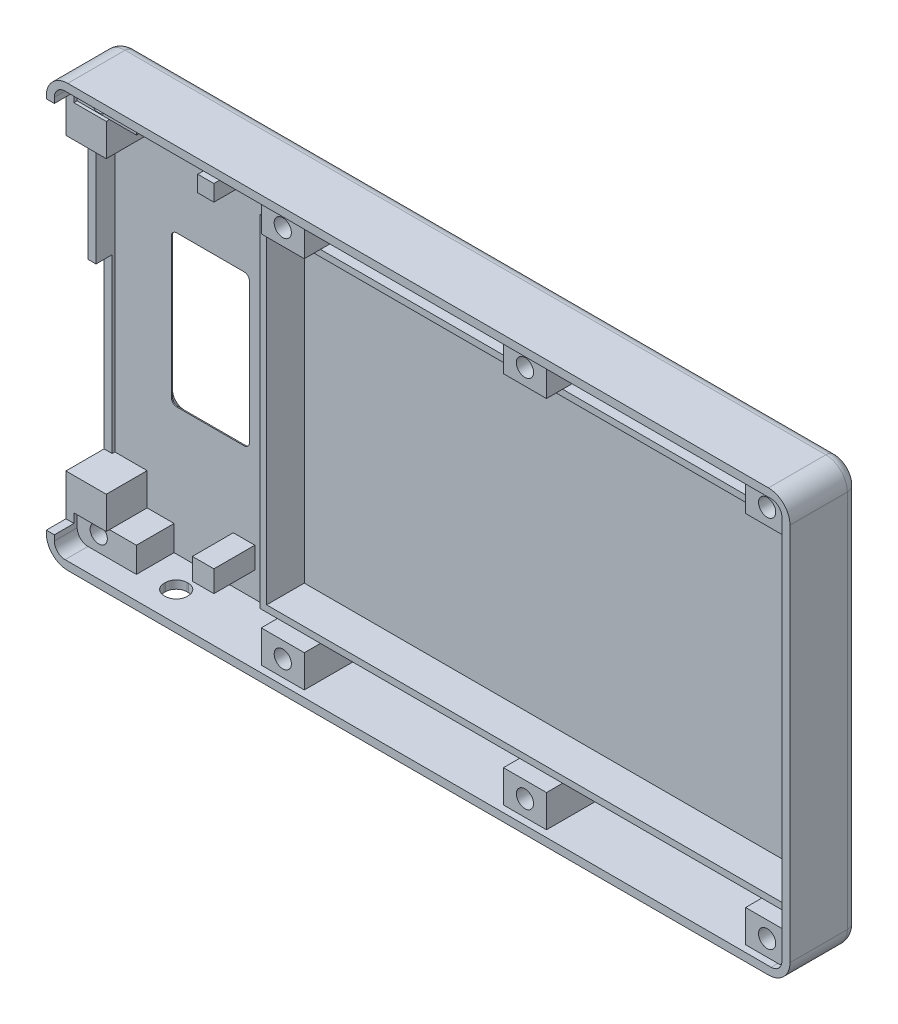
from build123d import *

# Parameters (mm, degrees)
BOSS_EXTRU_1_DEPTH           = 12.65
ESQUISSE1_4_W                = 135.2
ESQUISSE1_4_H                = 75.4
BOSS_EXTRU_2_DEPTH           = 1.4
BOSS_EXTRU_5_START           = 1.4
ESQUISSE1_5_W                = 8
ESQUISSE1_5_H                = 6
ESQUISSE1_5_R                = 1.25
BOSS_EXTRU_5_DEPTH           = 10
BOSS_EXTRU_5_2_DEPTH         = 10
BOSS_EXTRU_5_3_DEPTH         = 10
BOSS_EXTRU_5_4_DEPTH         = 10
BOSS_EXTRU_5_5_DEPTH         = 10
BOSS_EXTRU_5_6_DEPTH         = 10
BOSS_EXTRU_7_START           = 1.4
BOSS_EXTRU_7_DEPTH           = 7
CONG_1_R                     = 4
CONG_2_R                     = 2
ENL_V_MAT_EXTRU_2_DEPTH      = 4.3
ENL_V_MAT_EXTRU_2_DEPTH_BACK = 60.5
ESQUISSE4_R                  = 1.6
BOSS_EXTRU_9_START           = 1.4
ESQUISSE1_9_W                = 6
ESQUISSE1_9_H                = 6
ESQUISSE1_9_W_2              = 4
ESQUISSE1_9_H_2              = 4
ESQUISSE1_9_W_3              = 3
ESQUISSE1_9_H_3              = 3
BOSS_EXTRU_9_DEPTH           = 7.6
ESQUISSE5_W                  = 11
ESQUISSE5_H                  = 4.7
BOSS_EXTRU_10_DEPTH          = 7
ESQUISSE6_R                  = 1.6
ENL_V_MAT_EXTRU_3_DEPTH      = 40
CHANFREIN3_SIZE              = 1.48
ENL_V_MAT_EXTRU_6_DEPTH      = 1.4
ENL_V_MAT_EXTRU_7_DEPTH      = 3
CHANFREIN4_SIZE              = 1.2
CONG_3_R                     = 2
ESQUISSE12_W                 = 1.5
ESQUISSE12_H                 = 32
ENL_V_MAT_EXTRU_8_DEPTH      = 10.75
ESQUISSE13_W                 = 1.5
ESQUISSE13_H                 = 22
ENL_V_MAT_EXTRU_9_DEPTH      = 7.75
ESQUISSE11_W                 = 1.5
ESQUISSE11_H                 = 7.7
ENL_V_MAT_EXTRU_10_DEPTH     = 3.65


with BuildPart() as part:
    # Esquisse1 → Boss.-Extru.1 (new body)
    with BuildSketch(Plane.XY):
        Polygon((135.2, 75.4), (135.2, 69.4), (135.2, 68.2), (135.2, 37.7), (136.7, 37.7), (136.7, 76.9), (-1.5, 76.9), (-1.5, 37.7), (0, 37.7), (0, 64.7), (0, 70.7), (0, 72.1), (0, 75.4), (37.2, 75.4), (45.2, 75.4), (82.2, 75.4), (90.2, 75.4), (127.2, 75.4), align=None)
        Polygon((136.7, 37.7), (135.2, 37.7), (135.2, 7.2), (135.2, 6), (135.2, 0), (127.2, 0), (90.2, 0), (82.2, 0), (45.2, 0), (37.2, 0), (0, 0), (0, 3.3), (0, 4.7), (0, 10.7), (0, 37.7), (-1.5, 37.7), (-1.5, -1.5), (136.7, -1.5), align=None)
    extrude(amount=BOSS_EXTRU_1_DEPTH)

    # Esquisse1<4> → Boss.-Extru.2 (add)
    with BuildSketch(Plane.XY):
        with Locations((67.6, 37.7)):
            Rectangle(ESQUISSE1_4_W, ESQUISSE1_4_H)
    extrude(amount=BOSS_EXTRU_2_DEPTH)

    # Esquisse1<6> → Boss.-Extru.7 (add)
    with BuildSketch(Plane.XY.offset(BOSS_EXTRU_7_START)):
        Polygon((135.2, 68.2), (135.2, 69.4), (127.2, 69.4), (90.2, 69.4), (82.2, 69.4), (45.2, 69.4), (37.2, 69.4), (34, 69.4), (34, 37.7), (35.2, 37.7), (35.2, 68.2), align=None)
        Polygon((135.2, 6), (135.2, 7.2), (35.2, 7.2), (35.2, 37.7), (34, 37.7), (34, 6), (37.2, 6), (45.2, 6), (82.2, 6), (90.2, 6), (127.2, 6), align=None)
    extrude(amount=BOSS_EXTRU_7_DEPTH)

    # Congé1
    cong_1_edges = [part.edges().sort_by_distance(p)[0] for p in [
        (-1.5, 76.9, 6.325),
        (136.7, 76.9, 6.325),
        (136.7, -1.5, 6.325),
        (-1.5, -1.5, 6.325),
    ]]
    fillet(cong_1_edges, radius=CONG_1_R)

    # Congé2
    cong_2_edges = [part.edges().sort_by_distance(p)[0] for p in [
        (135.2, 0, 7.025),
        (135.2, 75.4, 7.025),
        (0, 75.4, 7.025),
        (0, 0, 7.025),
    ]]
    fillet(cong_2_edges, radius=CONG_2_R)


with BuildPart() as body_2:
    # Esquisse1<5> → Boss.-Extru.5 (new body)
    with BuildSketch(Plane.XY.offset(BOSS_EXTRU_5_START)):
        with Locations((131.2, 72.4)):
            Rectangle(ESQUISSE1_5_W, ESQUISSE1_5_H)
        with Locations(Location((131.2, 72.4, 0), (0, 0, 180))):
            Circle(ESQUISSE1_5_R, mode=Mode.SUBTRACT)
    extrude(amount=BOSS_EXTRU_5_DEPTH)


with BuildPart() as body_3:
    # Esquisse1<5> → Boss.-Extru.5 2 (new body)
    with BuildSketch(Plane.XY.offset(BOSS_EXTRU_5_START)):
        with Locations((86.2, 72.4)):
            Rectangle(ESQUISSE1_5_W, ESQUISSE1_5_H)
        with Locations(Location((86.2, 72.4, 0), (0, 0, 180))):
            Circle(ESQUISSE1_5_R, mode=Mode.SUBTRACT)
    extrude(amount=BOSS_EXTRU_5_2_DEPTH)


with BuildPart() as body_4:
    # Esquisse1<5> → Boss.-Extru.5 3 (new body)
    with BuildSketch(Plane.XY.offset(BOSS_EXTRU_5_START)):
        with Locations((131.2, 3)):
            Rectangle(ESQUISSE1_5_W, ESQUISSE1_5_H)
        with Locations(Location((131.2, 3, 0), (0, 0, 180))):
            Circle(ESQUISSE1_5_R, mode=Mode.SUBTRACT)
    extrude(amount=BOSS_EXTRU_5_3_DEPTH)


with BuildPart() as body_5:
    # Esquisse1<5> → Boss.-Extru.5 4 (new body)
    with BuildSketch(Plane.XY.offset(BOSS_EXTRU_5_START)):
        with Locations((41.2, 72.4)):
            Rectangle(ESQUISSE1_5_W, ESQUISSE1_5_H)
        with Locations(Location((41.2, 72.4, 0), (0, 0, 180))):
            Circle(ESQUISSE1_5_R, mode=Mode.SUBTRACT)
    extrude(amount=BOSS_EXTRU_5_4_DEPTH)


with BuildPart() as body_6:
    # Esquisse1<5> → Boss.-Extru.5 5 (new body)
    with BuildSketch(Plane.XY.offset(BOSS_EXTRU_5_START)):
        with Locations((86.2, 3)):
            Rectangle(ESQUISSE1_5_W, ESQUISSE1_5_H)
        with Locations(Location((86.2, 3, 0), (0, 0, 180))):
            Circle(ESQUISSE1_5_R, mode=Mode.SUBTRACT)
    extrude(amount=BOSS_EXTRU_5_5_DEPTH)


with BuildPart() as body_7:
    # Esquisse1<5> → Boss.-Extru.5 6 (new body)
    with BuildSketch(Plane.XY.offset(BOSS_EXTRU_5_START)):
        with Locations((41.2, 3)):
            Rectangle(ESQUISSE1_5_W, ESQUISSE1_5_H)
        with Locations(Location((41.2, 3, 0), (0, 0, 180))):
            Circle(ESQUISSE1_5_R, mode=Mode.SUBTRACT)
    extrude(amount=BOSS_EXTRU_5_6_DEPTH)


with BuildPart() as enl_v_mat_extru_2_tool:
    # Esquisse4 → Enlèv. mat.-Extru.2 (new, two sides: drawn at the far end of the back side and taken through both)
    with BuildSketch(Plane(origin=(0, 0, 0), x_dir=(-1, 0, 0), z_dir=(0, 0, -1)).offset(-ENL_V_MAT_EXTRU_2_DEPTH_BACK)):
        with Locations(Location((-41.2, 3, 0), (0, 0, 180))):
            Circle(ESQUISSE4_R)
        with Locations(Location((-86.2, 3, 0), (0, 0, 180))):
            Circle(ESQUISSE4_R)
        with Locations(Location((-131.2, 3, 0), (0, 0, 180))):
            Circle(ESQUISSE4_R)
        with Locations(Location((-131.2, 72.4, 0), (0, 0, 180))):
            Circle(ESQUISSE4_R)
        with Locations(Location((-86.2, 72.4, 0), (0, 0, 180))):
            Circle(ESQUISSE4_R)
        with Locations(Location((-41.2, 72.4, 0), (0, 0, 180))):
            Circle(ESQUISSE4_R)
    extrude(amount=ENL_V_MAT_EXTRU_2_DEPTH + ENL_V_MAT_EXTRU_2_DEPTH_BACK)


with BuildPart() as part_1:
    add(part.part)

    # Enlèv. mat.-Extru.2: cut by enl_v_mat_extru_2_tool
    add(enl_v_mat_extru_2_tool.part, mode=Mode.SUBTRACT)

    # Esquisse1<9> → Boss.-Extru.9 (add)
    with BuildSketch(Plane.XY.offset(BOSS_EXTRU_9_START)):
        with Locations((3, 7.7)):
            Rectangle(ESQUISSE1_9_W, ESQUISSE1_9_H)
        with Locations((24, 6.7)):
            Rectangle(ESQUISSE1_9_W_2, ESQUISSE1_9_H_2)
        with Locations((3, 67.7)):
            Rectangle(ESQUISSE1_9_W, ESQUISSE1_9_H)
        with Locations((24.5, 69.2)):
            Rectangle(ESQUISSE1_9_W_3, ESQUISSE1_9_H_3)
    extrude(amount=BOSS_EXTRU_9_DEPTH)

    # Esquisse5 → Boss.-Extru.10 (add)
    with BuildSketch(Plane.XY.offset(1.4)):
        with Locations((5.5, 73.05)):
            Rectangle(ESQUISSE5_W, ESQUISSE5_H)
        with Locations((5.5, 2.35)):
            Rectangle(ESQUISSE5_W, ESQUISSE5_H)
    extrude(amount=BOSS_EXTRU_10_DEPTH)

    # Esquisse6 → Enlèv. mat.-Extru.3 (cut)
    with BuildSketch(Plane(origin=(0, 0, 0), x_dir=(-1, 0, 0), z_dir=(0, 0, -1))):
        with Locations((-4, 3)):
            Circle(ESQUISSE6_R)
        with Locations((-4, 72.4)):
            Circle(ESQUISSE6_R)
    extrude(amount=-ENL_V_MAT_EXTRU_3_DEPTH, mode=Mode.SUBTRACT)

    # Chanfrein3
    # the kernel refuses this chamfer: 1.48 mm, written as the material it takes off along each edge
    with BuildSketch(Plane(origin=(41.2, 3, 0), x_dir=(1, 0, 0), z_dir=(0, 1, 0))) as chanfrein3_piece_1:
        Polygon((1.6 + CHANFREIN3_SIZE, 0), (1.6, -CHANFREIN3_SIZE), (1.6, 0), align=None)
    revolve(axis=Axis((41.2, 3, 0), (0, 0, -1)), mode=Mode.SUBTRACT)
    with BuildSketch(Plane(origin=(86.2, 3, 0), x_dir=(1, 0, 0), z_dir=(0, 1, 0))) as chanfrein3_piece_2:
        Polygon((1.6 + CHANFREIN3_SIZE, 0), (1.6, -CHANFREIN3_SIZE), (1.6, 0), align=None)
    revolve(axis=Axis((86.2, 3, 0), (0, 0, -1)), mode=Mode.SUBTRACT)
    with BuildSketch(Plane(origin=(131.2, 3, 0), x_dir=(1, 0, 0), z_dir=(0, 1, 0))) as chanfrein3_piece_3:
        Polygon((1.6 + CHANFREIN3_SIZE, 0), (1.6, -CHANFREIN3_SIZE), (1.6, 0), align=None)
    revolve(axis=Axis((131.2, 3, 0), (0, 0, -1)), mode=Mode.SUBTRACT)
    with BuildSketch(Plane(origin=(131.2, 72.4, 0), x_dir=(1, 0, 0), z_dir=(0, 1, 0))) as chanfrein3_piece_4:
        Polygon((1.6 + CHANFREIN3_SIZE, 0), (1.6, -CHANFREIN3_SIZE), (1.6, 0), align=None)
    revolve(axis=Axis((131.2, 72.4, 0), (0, 0, -1)), mode=Mode.SUBTRACT)
    with BuildSketch(Plane(origin=(86.2, 72.4, 0), x_dir=(1, 0, 0), z_dir=(0, 1, 0))) as chanfrein3_piece_5:
        Polygon((1.6 + CHANFREIN3_SIZE, 0), (1.6, -CHANFREIN3_SIZE), (1.6, 0), align=None)
    revolve(axis=Axis((86.2, 72.4, 0), (0, 0, -1)), mode=Mode.SUBTRACT)
    with BuildSketch(Plane(origin=(41.2, 72.4, 0), x_dir=(1, 0, 0), z_dir=(0, 1, 0))) as chanfrein3_piece_6:
        Polygon((1.6 + CHANFREIN3_SIZE, 0), (1.6, -CHANFREIN3_SIZE), (1.6, 0), align=None)
    revolve(axis=Axis((41.2, 72.4, 0), (0, 0, -1)), mode=Mode.SUBTRACT)
    with BuildSketch(Plane(origin=(4, 3, 0), x_dir=(-1, 0, 0), z_dir=(0, -1, 0))) as chanfrein3_piece_7:
        Polygon((1.6 + CHANFREIN3_SIZE, 0), (1.6, -CHANFREIN3_SIZE), (1.6, 0), align=None)
    revolve(axis=Axis((4, 3, 0), (0, 0, -1)), mode=Mode.SUBTRACT)
    with BuildSketch(Plane(origin=(4, 72.4, 0), x_dir=(-1, 0, 0), z_dir=(0, -1, 0))) as chanfrein3_piece_8:
        Polygon((1.6 + CHANFREIN3_SIZE, 0), (1.6, -CHANFREIN3_SIZE), (1.6, 0), align=None)
    revolve(axis=Axis((4, 72.4, 0), (0, 0, -1)), mode=Mode.SUBTRACT)

    # Esquisse9 → Enlèv. mat.-Extru.6 (cut)
    with BuildSketch(Plane(origin=(0, 0, 0), x_dir=(-1, 0, 0), z_dir=(0, 0, -1))):
        with BuildLine():
            Line((-11.5, 23.7), (-24, 23.7))
            ThreePointArc((-24, 23.7), (-24.707106781, 23.992893219), (-25, 24.7))
            Line((-25, 24.7), (-25, 50.7))
            ThreePointArc((-25, 50.7), (-24.707106781, 51.407106781), (-24, 51.7))
            Line((-24, 51.7), (-11.5, 51.7))
            ThreePointArc((-11.5, 51.7), (-10.792893219, 51.407106781), (-10.5, 50.7))
            Line((-10.5, 50.7), (-10.5, 24.7))
            ThreePointArc((-10.5, 24.7), (-10.792893219, 23.992893219), (-11.5, 23.7))
        make_face()
    extrude(amount=-ENL_V_MAT_EXTRU_6_DEPTH, mode=Mode.SUBTRACT)

    # Esquisse10 → Enlèv. mat.-Extru.7 (cut)
    with BuildSketch(Plane.XZ.offset(1.5)):
        with BuildLine():
            Line((17.25, 9.25), (17, 9.25))
            ThreePointArc((17, 9.25), (15.585786438, 8.664213562), (15, 7.25))
            Line((15, 7.25), (15, 7))
            ThreePointArc((15, 7), (15.585786438, 5.585786438), (17, 5))
            Line((17, 5), (17.25, 5))
            ThreePointArc((17.25, 5), (18.664213562, 5.585786438), (19.25, 7))
            Line((19.25, 7), (19.25, 7.25))
            ThreePointArc((19.25, 7.25), (18.664213562, 8.664213562), (17.25, 9.25))
        make_face()
    extrude(amount=-ENL_V_MAT_EXTRU_7_DEPTH, mode=Mode.SUBTRACT)

    # Chanfrein4
    chanfrein4_edges = [part_1.edges().sort_by_distance(p)[0] for p in [
        (10.792893219, 51.407106781, 0),
        (17.75, 51.7, 0),
        (24.707106781, 51.407106781, 0),
        (25, 37.7, 0),
        (24.707106781, 23.992893219, 0),
        (17.75, 23.7, 0),
        (10.792893219, 23.992893219, 0),
        (10.5, 37.7, 0),
    ]]
    chamfer(chanfrein4_edges, length=CHANFREIN4_SIZE)

    # Congé3
    # the kernel refuses this fillet: 2 mm, written as the material it takes off along each edge
    with BuildSketch(Plane(origin=(-1.5, 2.5, 0), x_dir=(1, 0, 0), z_dir=(0, 1, 0)), Plane(origin=(136.7, 72.9, 0), x_dir=(-1, 0, 0), z_dir=(0, -1, 0))) as cong_3_piece_1:
        with BuildLine():
            CenterArc((CONG_3_R, -CONG_3_R), CONG_3_R, 90, 90)
            Line((0, -CONG_3_R), (0, 0))
            Line((0, 0), (CONG_3_R, 0))
        make_face()
    extrude(amount=70.4, mode=Mode.SUBTRACT)
    with BuildSketch(Plane(origin=(132.7, 76.9, 0), x_dir=(0, -1, 0), z_dir=(-1, 0, 0)), Plane(origin=(2.5, -1.5, 0), x_dir=(0, 1, 0), z_dir=(1, 0, 0))) as cong_3_piece_2:
        with BuildLine():
            CenterArc((CONG_3_R, CONG_3_R), CONG_3_R, 180, 90)
            Line((0, CONG_3_R), (0, 0))
            Line((0, 0), (CONG_3_R, 0))
        make_face()
    extrude(amount=130.2, mode=Mode.SUBTRACT)
    with BuildSketch(Plane(origin=(132.7, 72.9, 0), x_dir=(0, 1, 0), z_dir=(-1, 0, 0))) as cong_3_piece_3:
        with BuildLine():
            CenterArc((4 - CONG_3_R, -CONG_3_R), CONG_3_R, 0, 90)
            Line((4, -CONG_3_R), (4, 0))
            Line((4, 0), (4 - CONG_3_R, 0))
        make_face()
    revolve(axis=Axis((132.7, 72.9, 0), (0, 0, -1)), revolution_arc=90, mode=Mode.SUBTRACT)
    with BuildSketch(Plane(origin=(132.7, 2.5, 0), x_dir=(0, -1, 0), z_dir=(-1, 0, 0))) as cong_3_piece_4:
        with BuildLine():
            CenterArc((4 - CONG_3_R, CONG_3_R), CONG_3_R, 270, 90)
            Line((4, CONG_3_R), (4, 0))
            Line((4, 0), (4 - CONG_3_R, 0))
        make_face()
    revolve(axis=Axis((132.7, 2.5, 0), (0, 0, 1)), revolution_arc=90, mode=Mode.SUBTRACT)
    with BuildSketch(Plane(origin=(2.5, 2.5, 0), x_dir=(-1, 0, 0), z_dir=(0, 1, 0))) as cong_3_piece_5:
        with BuildLine():
            CenterArc((4 - CONG_3_R, CONG_3_R), CONG_3_R, 270, 90)
            Line((4, CONG_3_R), (4, 0))
            Line((4, 0), (4 - CONG_3_R, 0))
        make_face()
    revolve(axis=Axis((2.5, 2.5, 0), (0, 0, 1)), revolution_arc=90, mode=Mode.SUBTRACT)
    with BuildSketch(Plane(origin=(2.5, 72.9, 0), x_dir=(0, 1, 0), z_dir=(1, 0, 0))) as cong_3_piece_6:
        with BuildLine():
            CenterArc((4 - CONG_3_R, CONG_3_R), CONG_3_R, 270, 90)
            Line((4, CONG_3_R), (4, 0))
            Line((4, 0), (4 - CONG_3_R, 0))
        make_face()
    revolve(axis=Axis((2.5, 72.9, 0), (0, 0, 1)), revolution_arc=90, mode=Mode.SUBTRACT)

    # Esquisse12 → Enlèv. mat.-Extru.8 (cut)
    with BuildSketch(Plane.XY.offset(12.65)):
        with Locations((-0.75, 26.7)):
            Rectangle(ESQUISSE12_W, ESQUISSE12_H)
    extrude(amount=-ENL_V_MAT_EXTRU_8_DEPTH, mode=Mode.SUBTRACT)

    # Esquisse13 → Enlèv. mat.-Extru.9 (cut)
    with BuildSketch(Plane.XY.offset(12.65)):
        with Locations((-0.75, 53.7)):
            Rectangle(ESQUISSE13_W, ESQUISSE13_H)
    extrude(amount=-ENL_V_MAT_EXTRU_9_DEPTH, mode=Mode.SUBTRACT)

    # Esquisse11 → Enlèv. mat.-Extru.10 (cut)
    with BuildSketch(Plane.XY.offset(12.65)):
        with Locations((-0.75, 68.55)):
            Rectangle(ESQUISSE11_W, ESQUISSE11_H)
        with Locations((-0.75, 6.85)):
            Rectangle(ESQUISSE11_W, ESQUISSE11_H)
    extrude(amount=-ENL_V_MAT_EXTRU_10_DEPTH, mode=Mode.SUBTRACT)


with BuildPart() as body_2_1:
    add(body_2.part)

    # Enlèv. mat.-Extru.2: cut by enl_v_mat_extru_2_tool
    add(enl_v_mat_extru_2_tool.part, mode=Mode.SUBTRACT)


with BuildPart() as body_3_1:
    add(body_3.part)

    # Enlèv. mat.-Extru.2: cut by enl_v_mat_extru_2_tool
    add(enl_v_mat_extru_2_tool.part, mode=Mode.SUBTRACT)


with BuildPart() as body_4_1:
    add(body_4.part)

    # Enlèv. mat.-Extru.2: cut by enl_v_mat_extru_2_tool
    add(enl_v_mat_extru_2_tool.part, mode=Mode.SUBTRACT)


with BuildPart() as body_5_1:
    add(body_5.part)

    # Enlèv. mat.-Extru.2: cut by enl_v_mat_extru_2_tool
    add(enl_v_mat_extru_2_tool.part, mode=Mode.SUBTRACT)


with BuildPart() as body_6_1:
    add(body_6.part)

    # Enlèv. mat.-Extru.2: cut by enl_v_mat_extru_2_tool
    add(enl_v_mat_extru_2_tool.part, mode=Mode.SUBTRACT)


with BuildPart() as body_7_1:
    add(body_7.part)

    # Enlèv. mat.-Extru.2: cut by enl_v_mat_extru_2_tool
    add(enl_v_mat_extru_2_tool.part, mode=Mode.SUBTRACT)


solid = Compound([part_1.part, body_2_1.part, body_3_1.part, body_4_1.part, body_5_1.part, body_6_1.part, body_7_1.part])
